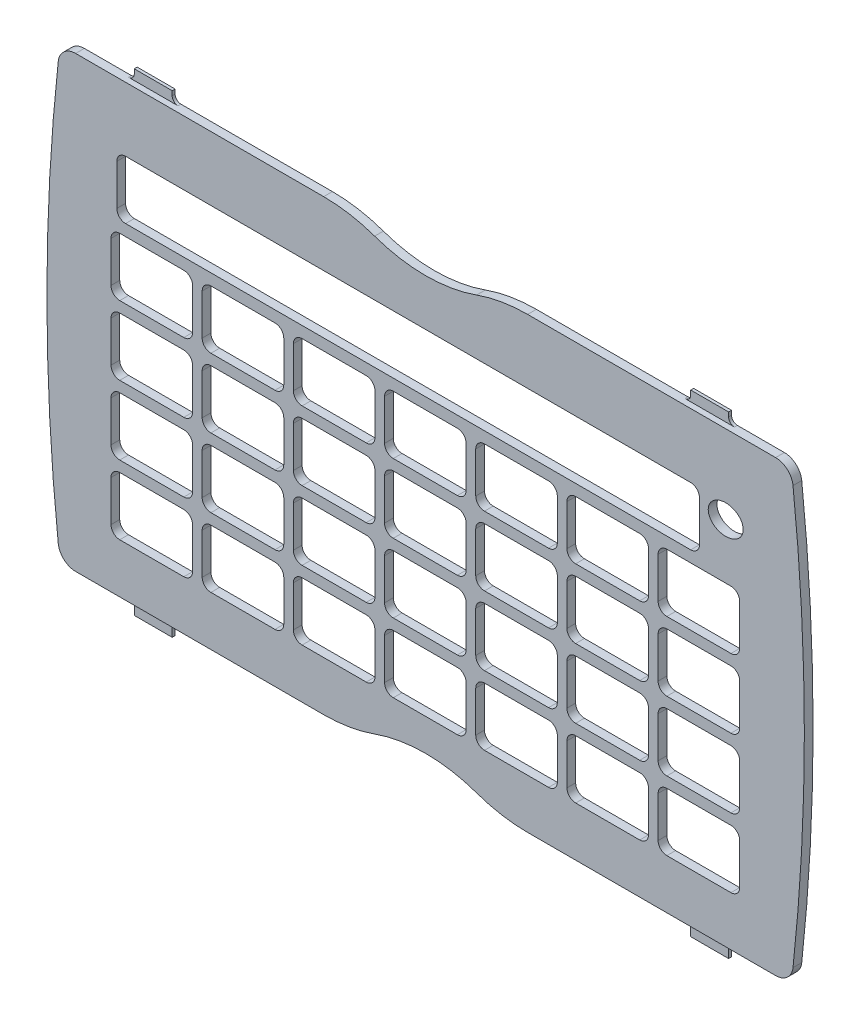
from build123d import *

# Parameters (mm, degrees)
OUTSIDE_DEPTH        = 3
CORNER_R             = 6
CUTOUT_DEPTH         = 152.122466894
LPATTERN1_COUNT      = 7
LPATTERN1_PITCH      = 31.3
LPATTERN1_COUNT_DIR2 = 4
LPATTERN1_PITCH_DIR2 = 23.7
SKETCH4_RX           = 6
SKETCH4_RY           = 5
SKETCH4_W            = 200
SKETCH4_H            = 20
TOP_OPENING_DEPTH    = 152.122466894
CURVE_DEPTH          = 152.122467033
SKETCH7_W            = 13
SKETCH7_H            = 1
TAB_DEPTH            = 5
TAB_CORNER_R         = 2
SKETCH8_W            = 13
SKETCH8_H            = 1.5
TRIM_BACK_DEPTH      = 154.71402032
FILLET1_R            = 3


with BuildPart() as part:
    # Sketch1 → Outside (new body)
    with BuildSketch(Plane.XY):
        with BuildLine():
            Line((-125.5, -77), (125.5, -77))
            ThreePointArc((125.5, -77), (130, 0), (125.5, 77))
            Line((125.5, 77), (-125.5, 77))
            ThreePointArc((-125.5, 77), (-130, 0), (-125.5, -77))
        make_face()
    extrude(amount=OUTSIDE_DEPTH)

    # Corner
    corner_edges = [part.edges().sort_by_distance(p)[0] for p in [
        (125.5, -77, 1.5),
        (-125.5, -77, 1.5),
        (-125.5, 77, 1.5),
        (125.5, 77, 1.5),
    ]]
    fillet(corner_edges, radius=CORNER_R)

    # Sketch2 → Cutout (cut, through all)
    with BuildSketch(Plane.XY.offset(3)):
        with BuildLine():
            Line((-105, -60), (-83, -60))
            ThreePointArc((-83, -60), (-80.878679656, -59.121320344), (-80, -57))
            Line((-80, -57), (-80, -43))
            ThreePointArc((-80, -43), (-80.878679656, -40.878679656), (-83, -40))
            Line((-83, -40), (-105, -40))
            ThreePointArc((-105, -40), (-107.121320344, -40.878679656), (-108, -43))
            Line((-108, -43), (-108, -57))
            ThreePointArc((-108, -57), (-107.121320344, -59.121320344), (-105, -60))
        make_face()
    cutout = extrude(amount=-CUTOUT_DEPTH, mode=Mode.SUBTRACT)

    # LPattern1: Cutout 7 × 4
    with Locations(*[(i * LPATTERN1_PITCH, j * LPATTERN1_PITCH_DIR2, 0) for i in range(LPATTERN1_COUNT) for j in range(LPATTERN1_COUNT_DIR2) if (i, j) != (0, 0)]):
        add(cutout, mode=Mode.SUBTRACT)

    # Sketch4 → Top Opening (cut, through all)
    with BuildSketch(Plane.XY.offset(3)):
        with Locations((103, 50)):
            Ellipse(SKETCH4_RX, SKETCH4_RY)
        with Locations((-6, 45)):
            Rectangle(SKETCH4_W, SKETCH4_H)
    extrude(amount=-TOP_OPENING_DEPTH, mode=Mode.SUBTRACT)

    # Sketch5 → Curve (cut, through all)
    with BuildSketch(Plane.XY.offset(3)):
        with BuildLine():
            Line((-35, -77), (35, -77))
            ThreePointArc((35, -77), (26.122359548, -76.244569305), (17.5, -74))
            ThreePointArc((17.5, -74), (0, -71), (-17.5, -74))
            ThreePointArc((-17.5, -74), (-26.122359548, -76.244569305), (-35, -77))
        make_face()
    curve = extrude(amount=-CURVE_DEPTH, mode=Mode.SUBTRACT)

    # Sketch7 → Tab (add)
    with BuildSketch(Plane.XZ.offset(77)):
        with Locations((95.5, 0.5)):
            Rectangle(SKETCH7_W, SKETCH7_H)
        with Locations((-95.5, 0.5)):
            Rectangle(SKETCH7_W, SKETCH7_H)
    tab = extrude(amount=TAB_DEPTH)

    # Tabs: Curve, Tab across plane
    add(curve.mirror(Plane.ZX), mode=Mode.SUBTRACT)
    add(tab.mirror(Plane.ZX))

    # Tab Corner
    tab_corner_edges = [part.edges().sort_by_distance(p)[0] for p in [
        (102, -77, 0.5),
        (89, -77, 0.5),
        (-89, -77, 0.5),
        (-102, -77, 0.5),
        (-102, 77, 0.5),
        (-89, 77, 0.5),
        (89, 77, 0.5),
        (102, 77, 0.5),
    ]]
    fillet(tab_corner_edges, radius=TAB_CORNER_R)

    # Sketch8 → Trim Back (cut, through all)
    with BuildSketch(Plane.XY.offset(1)):
        with Locations((-95.5, 81.25)):
            Rectangle(SKETCH8_W, SKETCH8_H)
        with Locations((95.5, 81.25)):
            Rectangle(SKETCH8_W, SKETCH8_H)
    extrude(amount=-TRIM_BACK_DEPTH, mode=Mode.SUBTRACT)

    # Fillet1
    fillet1_edges = [part.edges().sort_by_distance(p)[0] for p in [
        (94, 35, 1.5),
        (94, 55, 1.5),
        (-106, 35, 1.5),
        (-106, 55, 1.5),
    ]]
    fillet(fillet1_edges, radius=FILLET1_R)


solid = part.part
